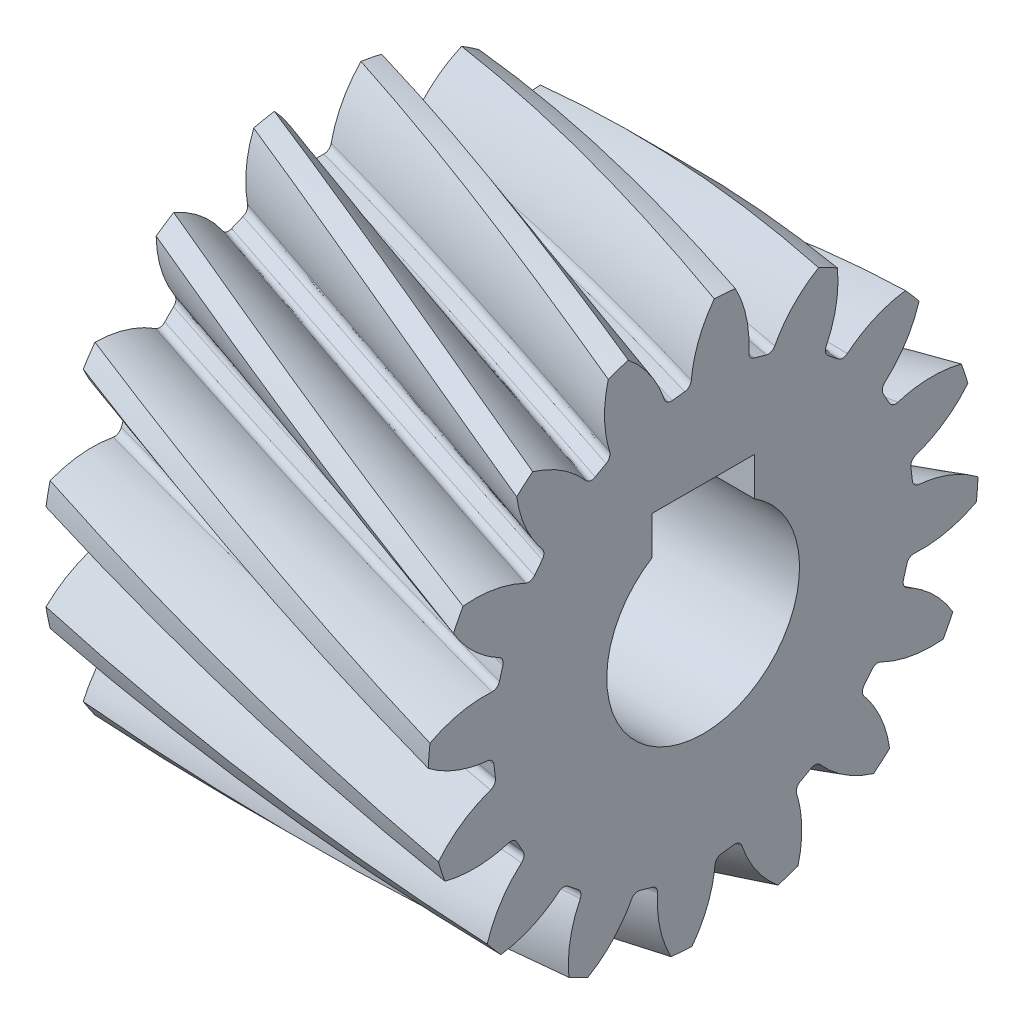
from build123d import *

# Parameters (mm, degrees)
BASPROSKE_W            = 30
BASPROSKE_H            = 21.405199905
TOOTHCUTRH_PITCH       = 369.516034213
TOOTHCUTRH_HEIGHT      = 30
TOOTHCUTRH_RADIUS      = 21.405199905
TOOTHCUTRH_START_ANGLE = -90
TEETHCUTSRH_COUNT      = 16
BORSKE_R               = 7.5
BORE_DEPTH             = 62.5000025
CUT_EXTRUDE1_DEPTH     = 43.61883599


with BuildPart() as part:
    # BasProSke → Base-Revolve (revolve)
    with BuildSketch(Plane(origin=(0, 0, 0), x_dir=(1, 0, 0), z_dir=(0, 1, 0)), mode=Mode.PRIVATE) as base_revolve_sk:
        with Locations((15, 10.702599952)):
            Rectangle(BASPROSKE_W, BASPROSKE_H)
    revolve(base_revolve_sk.sketch.rotate(Axis((-10, 0, 0), (1, 0, 0)), 180), axis=Axis((-10, 0, 0), (1, 0, 0)))

    # ToothCutRH: sweep along a helix
    with BuildLine() as toothcutrh_path:
        add(Helix(TOOTHCUTRH_PITCH, TOOTHCUTRH_HEIGHT, TOOTHCUTRH_RADIUS, center=(0, 0, 0), direction=(1, 0, 0), mode=Mode.PRIVATE).rotate(Axis((0, 0, 0), (1, 0, 0)), TOOTHCUTRH_START_ANGLE))
    # TooCutSkeRH → ToothCutRH (sweep, cut)
    with BuildSketch(Plane(origin=(0, 0, 0), x_dir=(0, 0, -1), z_dir=(1, 0, 0))):
        with BuildLine():
            ThreePointArc((0.484319557, 16.335521869), (0, 16.342699905), (-0.484319557, 16.335521869))
            ThreePointArc((-0.484319557, 16.335521869), (-0.848836448, 16.455428819), (-1.05205885, 16.780929812))
            ThreePointArc((-1.05205885, 16.780929812), (-2.101153363, 19.471300142), (-3.948280942, 21.690942346))
            ThreePointArc((-3.948280942, 21.690942346), (0, 22.047355902), (3.948280942, 21.690942346))
            ThreePointArc((3.948280942, 21.690942346), (2.101153363, 19.471300142), (1.05205885, 16.780929812))
            ThreePointArc((1.05205885, 16.780929812), (0.848836448, 16.455428819), (0.484319557, 16.335521869))
        make_face()
    toothcutrh = sweep(path=toothcutrh_path.line, is_frenet=True, mode=Mode.SUBTRACT)

    # TeethCutsRH: ToothCutRH ×16 about axis
    teethcutsrh_axis = Axis((-10, 0, 0), (1, 0, 0))
    for i in range(1, TEETHCUTSRH_COUNT):
        add(toothcutrh.rotate(teethcutsrh_axis, i * 360 / TEETHCUTSRH_COUNT), mode=Mode.SUBTRACT)

    # BorSke → Bore (cut, symmetric)
    with BuildSketch(Plane(origin=(0, 0, 0), x_dir=(0, 0, -1), z_dir=(1, 0, 0))):
        with Locations(Location((0, 0, 0), (0, 0, 180))):
            Circle(BORSKE_R)
    extrude(amount=BORE_DEPTH, both=True, mode=Mode.SUBTRACT)

    # Sketch3 → Cut-Extrude1 (cut, through all)
    with BuildSketch(Plane(origin=(30, 0, 0), x_dir=(0, 0, -1), z_dir=(1, 0, 0))):
        with BuildLine():
            ThreePointArc((-4, 6.34428877), (-2.081806214, 7.205281597), (0, 7.5))
            ThreePointArc((0, 7.5), (2.081806214, 7.205281597), (4, 6.34428877))
            Line((4, 6.34428877), (4, 9.34428877))
            Line((4, 9.34428877), (-4, 9.34428877))
            Line((-4, 9.34428877), (-4, 6.34428877))
        make_face()
    extrude(amount=-CUT_EXTRUDE1_DEPTH, mode=Mode.SUBTRACT)


solid = part.part
